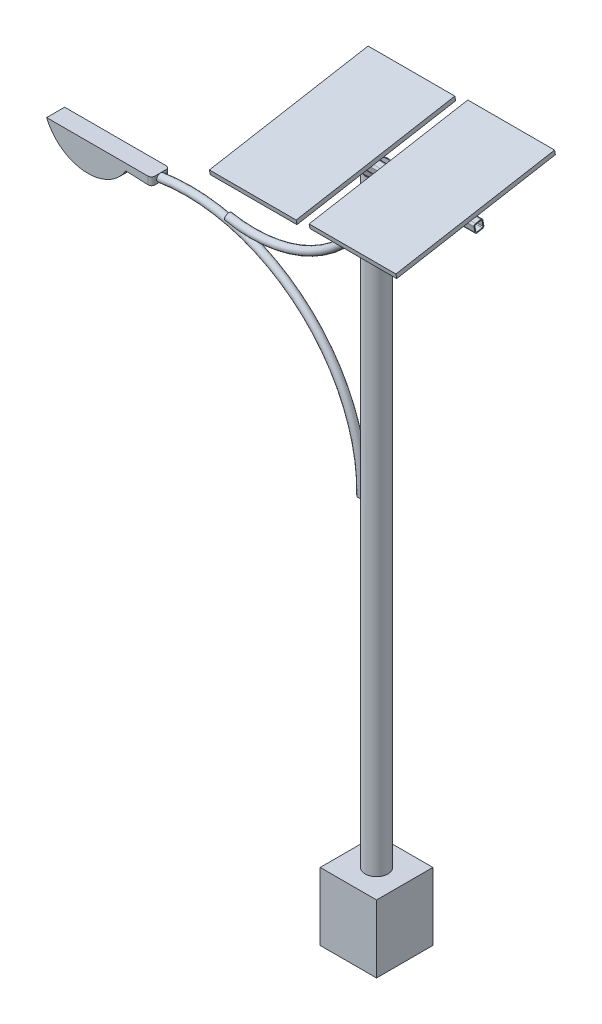
from build123d import *

# Parameters (mm, degrees)
SKETCH1_R                                  = 50.5
SKETCH1_R_2                                = 47.5
BOSS_EXTRUDE1_DEPTH                        = 3000
PIPE_CONFIGURED_33_7_X_4_0_1_OUTLINE_R     = 16.85
PIPE_CONFIGURED_33_7_X_4_0_1_OUTLINE_R_2   = 12.85
PIPE_CONFIGURED_33_7_X_4_0_1_ANGLE         = 71.246614
PIPE_CONFIGURED_33_7_X_4_0_1_2_OUTLINE_R   = 16.85
PIPE_CONFIGURED_33_7_X_4_0_1_2_OUTLINE_R_2 = 12.85
PIPE_CONFIGURED_33_7_X_4_0_1_2_ANGLE       = 100.735706
CUT_EXTRUDE1_DEPTH                         = 3152.650905186
CUT_EXTRUDE1_DEPTH_BACK                    = 3152.650905186
SQUARE_TUBE_CONFIGURED_40_X_40_X_4_1_DEPTH = 850
SKETCH15_W                                 = 385
SKETCH15_H                                 = 715
BOSS_EXTRUDE3_DEPTH                        = 20
SKETCH16_W                                 = 385
SKETCH16_H                                 = 715
BOSS_EXTRUDE4_DEPTH                        = 20
BOSS_EXTRUDE5_DEPTH                        = 40
FILLET1_R                                  = 15
SKETCH18_W                                 = 250
SKETCH18_H                                 = 250
BOSS_EXTRUDE6_DEPTH                        = 300


# Read off the part's stored shape, not the designer's step: Pipe - configured 33.7 X 4.0(1)
with BuildPart() as part:
    # Sketch1 → Boss-Extrude1 (new body)
    with BuildSketch(Plane(origin=(0, 0, 0), x_dir=(1, 0, 0), z_dir=(0, 1, 0))):
        with Locations(Location((0, 0, 0), (0, 0, 270))):
            Circle(SKETCH1_R)
        with Locations(Location((0, 0, 0), (0, 0, 270))):
            Circle(SKETCH1_R_2, mode=Mode.SUBTRACT)
    extrude(amount=BOSS_EXTRUDE1_DEPTH)

    # Sketch12 → Cut-Extrude1 (cut, two sides: drawn at the far end of the back side and taken through both)
    with BuildSketch(Plane(origin=(0, 0, 0), x_dir=(0, 0, -1), z_dir=(1, 0, 0)).offset(-CUT_EXTRUDE1_DEPTH_BACK)):
        Polygon((50.5, 3000), (-67.81337246, 2979.138160257), (-67.81337246, 3000), align=None)
    extrude(amount=CUT_EXTRUDE1_DEPTH + CUT_EXTRUDE1_DEPTH_BACK, mode=Mode.SUBTRACT)


with BuildPart() as body_2:
    # Pipe - configured 33.7 X 4.0(1) outline → Pipe - configured 33.7 X 4.0(1) (revolve)
    with BuildSketch(Plane(origin=(-549.839773, 3036.434615231, 0), x_dir=(-0.18849061162568545, -0.9820749917032685, 0), z_dir=(-0.9820749917032685, 0.18849061162568545, 0))):
        with Locations((574.390250582, 0)):
            Circle(PIPE_CONFIGURED_33_7_X_4_0_1_OUTLINE_R)
        with Locations((574.390250582, 0)):
            Circle(PIPE_CONFIGURED_33_7_X_4_0_1_OUTLINE_R_2, mode=Mode.SUBTRACT)
    revolve(axis=Axis((-549.839773, 3036.434615231, 0), (0, 0, 1)), revolution_arc=PIPE_CONFIGURED_33_7_X_4_0_1_ANGLE)


with BuildPart() as body_3:
    # Pipe - configured 33.7 X 4.0_1 2 outline → Pipe - configured 33.7 X 4.0_1 2 (revolve)
    with BuildSketch(Plane(origin=(-833.776532631, 1712.838993172, 0), x_dir=(0.9997918812705326, -0.020400836883055794, 0), z_dir=(-0.020400836883055794, -0.9997918812705326, 0))):
        with Locations((770, 0)):
            Circle(PIPE_CONFIGURED_33_7_X_4_0_1_2_OUTLINE_R)
        with Locations((770, 0)):
            Circle(PIPE_CONFIGURED_33_7_X_4_0_1_2_OUTLINE_R_2, mode=Mode.SUBTRACT)
    revolve(axis=Axis((-833.776532631, 1712.838993172, 0), (0, 0, 1)), revolution_arc=PIPE_CONFIGURED_33_7_X_4_0_1_2_ANGLE)


with BuildPart() as body_4:
    # Sketch14 → Square tube - configured 40 X 40 X 4(1) (new body)
    with BuildSketch(Plane(origin=(-395.975268768, 2991.129870244, -0.194994376), x_dir=(0, 0.17364817766692475, -0.984807753012209), z_dir=(1, 0, 0))):
        with BuildLine():
            Line((-12, -20), (12, -20))
            ThreePointArc((12, -20), (17.656854249, -17.656854249), (20, -12))
            Line((20, -12), (20, 12))
            ThreePointArc((20, 12), (17.656854249, 17.656854249), (12, 20))
            Line((12, 20), (-12, 20))
            ThreePointArc((-12, 20), (-17.656854249, 17.656854249), (-20, 12))
            Line((-20, 12), (-20, -12))
            ThreePointArc((-20, -12), (-17.656854249, -17.656854249), (-12, -20))
        make_face()
        with BuildLine():
            Line((-12, -16), (12, -16))
            ThreePointArc((12, -16), (14.828427125, -14.828427125), (16, -12))
            Line((16, -12), (16, 12))
            ThreePointArc((16, 12), (14.828427125, 14.828427125), (12, 16))
            Line((12, 16), (-12, 16))
            ThreePointArc((-12, 16), (-14.828427125, 14.828427125), (-16, 12))
            Line((-16, 12), (-16, -12))
            ThreePointArc((-16, -12), (-14.828427125, -14.828427125), (-12, -16))
        make_face(mode=Mode.SUBTRACT)
    extrude(amount=SQUARE_TUBE_CONFIGURED_40_X_40_X_4_1_DEPTH)


with BuildPart() as body_5:
    # Sketch15 → Boss-Extrude3 (new body)
    with BuildSketch(Plane(origin=(0, 2920.59907762, 514.980417217), x_dir=(1, 0, 0), z_dir=(0, 0.9848077530122089, 0.17364817766692592))):
        with Locations((-190.361050881, 519.596283107)):
            Rectangle(SKETCH15_W, SKETCH15_H)
    extrude(amount=BOSS_EXTRUDE3_DEPTH)


with BuildPart() as body_6:
    # Sketch16 → Boss-Extrude4 (new body)
    with BuildSketch(Plane(origin=(0, 2920.59907762, 514.980417217), x_dir=(1, 0, 0), z_dir=(0, 0.9848077530122089, 0.17364817766692592))):
        with Locations((240.421444589, 531.596283107)):
            Rectangle(SKETCH16_W, SKETCH16_H)
    extrude(amount=BOSS_EXTRUDE4_DEPTH)


with BuildPart() as body_7:
    # Sketch17 → Boss-Extrude5 (new, symmetric)
    with BuildSketch(Plane.XY):
        with BuildLine():
            Line((-958.947359374, 2455.51468729), (-958.947359374, 2489.669210551))
            Line((-958.947359374, 2489.669210551), (-1423.947359374, 2489.669210551))
            ThreePointArc((-1423.947359374, 2489.669210551), (-1257.011881852, 2367.257370091), (-1072.174349577, 2460.462514816))
            Line((-1072.174349577, 2460.462514816), (-958.947359374, 2455.51468729))
        make_face()
    extrude(amount=BOSS_EXTRUDE5_DEPTH, both=True)

    # Fillet1
    fillet1_edges = [body_7.edges().sort_by_distance(p)[0] for p in [
        (-958.947359374, 2472.59194892, -40),
        (-958.947359374, 2472.59194892, 40),
    ]]
    fillet(fillet1_edges, radius=FILLET1_R)


with BuildPart() as body_8:
    # Sketch18 → Boss-Extrude6 (new body)
    with BuildSketch(Plane.XZ):
        Rectangle(SKETCH18_W, SKETCH18_H)
    extrude(amount=-BOSS_EXTRUDE6_DEPTH)


solid = Compound([part.part, body_2.part, body_3.part, body_4.part, body_5.part, body_6.part, body_7.part, body_8.part])
